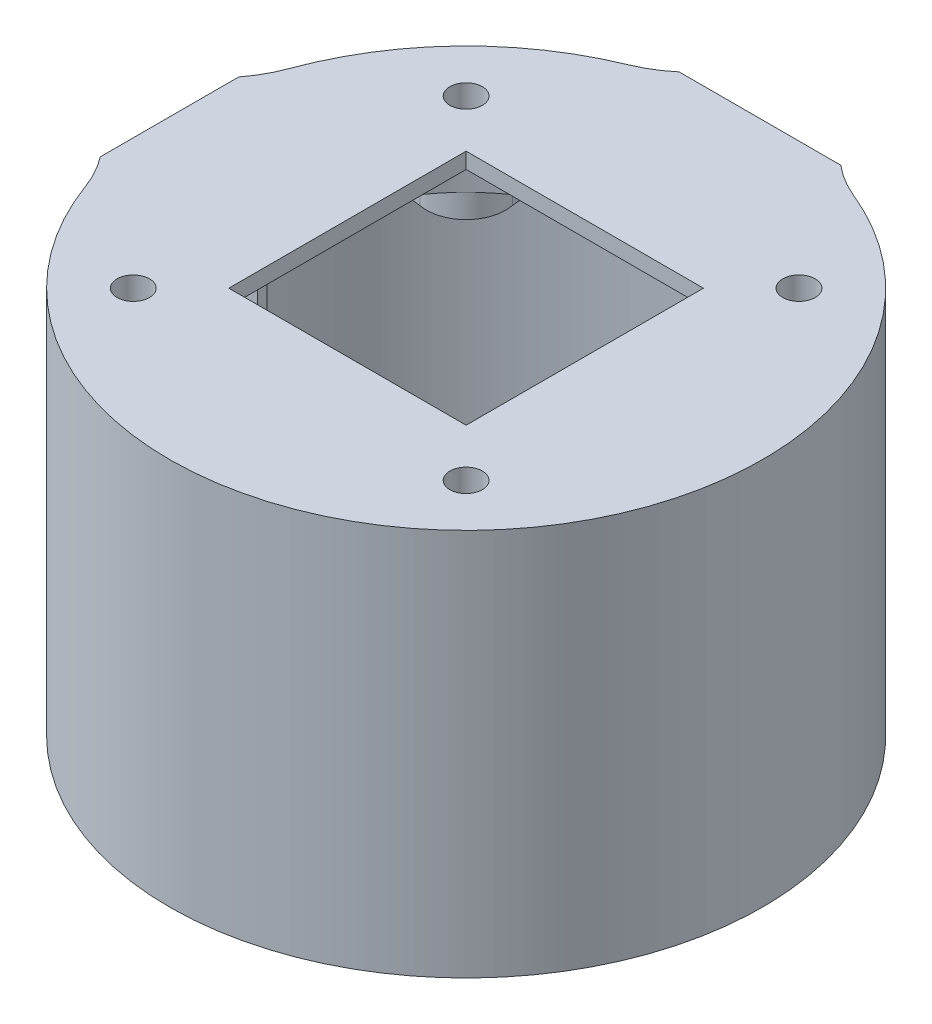
from build123d import *

# Parameters (mm, degrees)
SKETCH1_R               = 75
SKETCH1_R_2             = 70
BOSS_EXTRUDE1_DEPTH     = 78
SKETCH2_R               = 75
BOSS_EXTRUDE2_DEPTH     = 20
SKETCH3_R               = 4.1
SKETCH3_W               = 45
SKETCH3_H               = 45
CUT_EXTRUDE1_DEPTH      = 145.409140985
SKETCH5_W               = 45
SKETCH5_H               = 23
CUT_EXTRUDE2_DEPTH      = 18
SKETCH6_R               = 61
CUT_EXTRUDE3_DEPTH      = 6
SKETCH7_R               = 10
SKETCH7_R_2             = 4.1
BOSS_EXTRUDE3_DEPTH     = 6
SKETCH8_R               = 49.5
CUT_EXTRUDE4_DEPTH      = 10
CUT_EXTRUDE5_DEPTH      = 145.409140985
CUT_EXTRUDE5_DEPTH_BACK = 145.409140985
SKETCH10_W              = 15
SKETCH10_H              = 12.8
CUT_EXTRUDE6_DEPTH      = 10
CUT_EXTRUDE7_START      = -3
SKETCH11_W              = 20
SKETCH11_H              = 20
CUT_EXTRUDE7_DEPTH      = 10
CUT_EXTRUDE9_DEPTH      = 132.658649545
CUT_EXTRUDE9_DEPTH_BACK = 6
SKETCH13_R              = 9
BOSS_EXTRUDE4_DEPTH     = 98
SKETCH15_W              = 15.1
SKETCH15_H              = 22
CUT_EXTRUDE10_DEPTH     = 20.4
FILLET1_R               = 30
SKETCH16_W              = 15.1
SKETCH16_H              = 20
CUT_EXTRUDE11_DEPTH     = 2
SKETCH17_W              = 15.1
SKETCH17_H              = 12.8
CUT_EXTRUDE12_DEPTH     = 208.32046993
CHAMFER1_SIZE           = 20
CHAMFER1_SIZE2          = 69.748288877
CUT_EXTRUDE13_START     = -20
SKETCH20_W              = 10
SKETCH20_H              = 30
CUT_EXTRUDE13_DEPTH     = 30
BOSS_EXTRUDE6_START     = -48.000001
SKETCH21_W              = 7.222791441
SKETCH21_H              = 35
BOSS_EXTRUDE6_DEPTH     = 98.000001
SKETCH22_W              = 30
SKETCH22_H              = 30
CUT_EXTRUDE15_DEPTH     = 198.176147378
FILLET2_R               = 30
SKETCH23_W              = 60
SKETCH23_H              = 60
CUT_EXTRUDE16_DEPTH     = 156.300037396
SKETCH25_R              = 6
CUT_EXTRUDE17_DEPTH     = 6
SKETCH26_R              = 11
CUT_EXTRUDE18_DEPTH     = 6
FILLET4_R               = 10


with BuildPart() as part:
    # Sketch1 → Boss-Extrude1 (new body)
    with BuildSketch(Plane(origin=(0, 0, 0), x_dir=(1, 0, 0), z_dir=(0, 1, 0))):
        with Locations(Location((0, 0, 0), (0, 0, 270))):
            Circle(SKETCH1_R)
        with Locations(Location((0, 0, 0), (0, 0, 270))):
            Circle(SKETCH1_R_2, mode=Mode.SUBTRACT)
    extrude(amount=BOSS_EXTRUDE1_DEPTH)

    # Sketch2 → Boss-Extrude2 (add)
    with BuildSketch(Plane(origin=(0, 78, 0), x_dir=(1, 0, 0), z_dir=(0, 1, 0))):
        with Locations(Location((0, 0, 0), (0, 0, 270))):
            Circle(SKETCH2_R)
    extrude(amount=BOSS_EXTRUDE2_DEPTH)

    # Sketch3 → Cut-Extrude1 (cut, through all)
    with BuildSketch(Plane(origin=(0, 98, 0), x_dir=(1, 0, 0), z_dir=(0, 1, 0))):
        with Locations(Location((-42.072853481, -42.072853481, 0), (0, 0, 270))):
            Circle(SKETCH3_R)
        with Locations(Location((-42.072853481, 42.072853481, 0), (0, 0, 270))):
            Circle(SKETCH3_R)
        with Locations(Location((42.072853481, 42.072853481, 0), (0, 0, 270))):
            Circle(SKETCH3_R)
        with Locations(Location((42.072853481, -42.072853481, 0), (0, 0, 270))):
            Circle(SKETCH3_R)
        Rectangle(SKETCH3_W, SKETCH3_H)
    extrude(amount=-CUT_EXTRUDE1_DEPTH, mode=Mode.SUBTRACT)

    # Sketch5 → Cut-Extrude2 (cut)
    with BuildSketch(Plane.XZ.offset(-78)):
        with Locations((0, 34)):
            Rectangle(SKETCH5_W, SKETCH5_H)
    extrude(amount=-CUT_EXTRUDE2_DEPTH, mode=Mode.SUBTRACT)

    # Sketch6 → Cut-Extrude3 (cut)
    with BuildSketch(Plane.XZ.offset(-78)):
        Circle(SKETCH6_R)
    extrude(amount=-CUT_EXTRUDE3_DEPTH, mode=Mode.SUBTRACT)

    # Sketch7 → Boss-Extrude3 (add)
    # profile 1 of 4: a face of its own
    with BuildSketch(Plane.XZ.offset(-84)):
        with Locations((-42.072853481, -42.072853481)):
            Circle(SKETCH7_R)
        with Locations(Location((-42.072853481, -42.072853481, 0), (0, 0, 90))):
            Circle(SKETCH7_R_2, mode=Mode.SUBTRACT)
    # profile 2 of 4: a face of its own
    with BuildSketch(Plane.XZ.offset(-84)):
        with Locations((-42.072853481, 42.072853481)):
            Circle(SKETCH7_R)
        with Locations(Location((-42.072853481, 42.072853481, 0), (0, 0, 90))):
            Circle(SKETCH7_R_2, mode=Mode.SUBTRACT)
    # profile 3 of 4: a face of its own
    with BuildSketch(Plane.XZ.offset(-84)):
        with Locations((42.072853481, -42.072853481)):
            Circle(SKETCH7_R)
        with Locations(Location((42.072853481, -42.072853481, 0), (0, 0, 90))):
            Circle(SKETCH7_R_2, mode=Mode.SUBTRACT)
    # profile 4 of 4: a face of its own
    with BuildSketch(Plane.XZ.offset(-84)):
        with Locations((42.072853481, 42.072853481)):
            Circle(SKETCH7_R)
        with Locations(Location((42.072853481, 42.072853481, 0), (0, 0, 90))):
            Circle(SKETCH7_R_2, mode=Mode.SUBTRACT)
    extrude(amount=BOSS_EXTRUDE3_DEPTH)

    # Sketch8 → Cut-Extrude4 (cut)
    with BuildSketch(Plane.XZ.offset(-84)):
        Circle(SKETCH8_R)
    extrude(amount=-CUT_EXTRUDE4_DEPTH, mode=Mode.SUBTRACT)

    # Sketch9 → Cut-Extrude5 (cut, two sides: drawn at the far end of the back side and taken through both)
    with BuildSketch(Plane.XZ.offset(-CUT_EXTRUDE5_DEPTH_BACK)):
        Polygon((359.222745321, -74.624057783), (7.5, -74.624057783), (-7.5, -74.624057783), (-359.222745321, -74.624057783), (-359.222745321, -778.069548425), (359.222745321, -778.069548425), align=None)
    extrude(amount=CUT_EXTRUDE5_DEPTH + CUT_EXTRUDE5_DEPTH_BACK, mode=Mode.SUBTRACT)

    # Sketch10 → Cut-Extrude6 (cut)
    with BuildSketch(Plane(origin=(0, 0, -74.624057783), x_dir=(-1, 0, 0), z_dir=(0, 0, -1))):
        with Locations((0, 14)):
            Rectangle(SKETCH10_W, SKETCH10_H)
    extrude(amount=-CUT_EXTRUDE6_DEPTH, mode=Mode.SUBTRACT)

    # Sketch11 → Cut-Extrude7 (cut)
    with BuildSketch(Plane(origin=(0, 0, -74.624057783), x_dir=(-1, 0, 0), z_dir=(0, 0, -1)).offset(CUT_EXTRUDE7_START)):
        with Locations((0, 14)):
            Rectangle(SKETCH11_W, SKETCH11_H)
    extrude(amount=-CUT_EXTRUDE7_DEPTH, mode=Mode.SUBTRACT)

    # Sketch13 → Cut-Extrude9 (cut, two sides: drawn at the far end of the back side and taken through both)
    with BuildSketch(Plane.XZ.offset(-78).offset(-CUT_EXTRUDE9_DEPTH_BACK)):
        with Locations((61, 0)):
            Circle(SKETCH13_R)
    extrude(amount=CUT_EXTRUDE9_DEPTH + CUT_EXTRUDE9_DEPTH_BACK, mode=Mode.SUBTRACT)

    # Sketch14 → Boss-Extrude4 (add)
    with BuildSketch(Plane.XZ):
        with BuildLine():
            Line((10, -94.282032303), (-10, -94.282032303))
            Line((-10, -94.282032303), (-10, -69.282032303))
            ThreePointArc((-10, -69.282032303), (0, -70), (10, -69.282032303))
            Line((10, -69.282032303), (10, -94.282032303))
        make_face()
    extrude(amount=-BOSS_EXTRUDE4_DEPTH)

    # Sketch15 → Cut-Extrude10 (cut)
    with BuildSketch(Plane.XZ):
        with Locations((0, -80.591648206)):
            Rectangle(SKETCH15_W, SKETCH15_H)
    extrude(amount=-CUT_EXTRUDE10_DEPTH, mode=Mode.SUBTRACT)

    # Fillet1
    # the kernel refuses this fillet: 30 mm, written as the material it adds along each edge
    with BuildSketch(Plane(origin=(10, 98, -74.330343737), x_dir=(0, 0, -1), z_dir=(0, -1, 0))) as fillet1_piece_1:
        with BuildLine():
            CenterArc((22.808141372, 29.863701669), FILLET1_R, 202.312270951, 62.224029165)
            Line((-4.945711516, 18.474072621), (-5.500788574, 18.24628004))
            ThreePointArc((-5.500788574, 18.24628004), (-2.46118345, 9.240161115), (-0.59464275, -0.08))
            Line((-0.59464275, -0.08), (0, -0.6))
            ThreePointArc((0, -0.6), (9.975844283, -0.6), (19.89455951, -0.597274033))
            Line((19.89455951, -0.597274033), (19.951688566, 0))
        make_face()
    extrude(amount=98)
    with BuildSketch(Plane(origin=(-10, 98, -74.330343737), x_dir=(0, 0, -1), z_dir=(0, -1, 0))) as fillet1_piece_2:
        with BuildLine():
            CenterArc((22.808141372, -29.863701669), FILLET1_R, 95.463699883, 62.224029165)
            Line((-4.945711516, -18.474072621), (-5.500788574, -18.24628004))
            ThreePointArc((-5.500788574, -18.24628004), (-2.46118345, -9.240161115), (-0.59464275, 0.08))
            Line((-0.59464275, 0.08), (0, 0.6))
            ThreePointArc((0, 0.6), (9.975844283, 0.6), (19.89455951, 0.597274033))
            Line((19.89455951, 0.597274033), (19.951688566, 0))
        make_face()
    extrude(amount=98)

    # Sketch16 → Cut-Extrude11 (cut)
    with BuildSketch(Plane.XZ.offset(-20.4)):
        with Locations((0, -81.591648206)):
            Rectangle(SKETCH16_W, SKETCH16_H)
    extrude(amount=-CUT_EXTRUDE11_DEPTH, mode=Mode.SUBTRACT)

    # Sketch17 → Cut-Extrude12 (cut, through all)
    with BuildSketch(Plane.XY.offset(-91.591648206)):
        with Locations((0, 16)):
            Rectangle(SKETCH17_W, SKETCH17_H)
    extrude(amount=-CUT_EXTRUDE12_DEPTH, mode=Mode.SUBTRACT)

    # Chamfer1
    chamfer1_edges = [part.edges().sort_by_distance(p)[0] for p in [
        (0, 98, -94.282032303),
    ]]
    chamfer1_side = [part.faces().sort_by_distance(p)[0] for p in [
        (-13.95523156, 98, -77.914190335),
    ]]
    chamfer(chamfer1_edges, length=CHAMFER1_SIZE, length2=CHAMFER1_SIZE2, reference=chamfer1_side[0])

    # Sketch20 → Cut-Extrude13 (cut)
    with BuildSketch(Plane.XZ.offset(CUT_EXTRUDE13_START)):
        with Locations((-70, 0)):
            Rectangle(SKETCH20_W, SKETCH20_H)
    extrude(amount=-CUT_EXTRUDE13_DEPTH, mode=Mode.SUBTRACT)

    # Sketch21 → Boss-Extrude6 (add)
    with BuildSketch(Plane.XZ.offset(-50).offset(BOSS_EXTRUDE6_START)):
        with Locations((-71.38860428, 0)):
            Rectangle(SKETCH21_W, SKETCH21_H)
    extrude(amount=BOSS_EXTRUDE6_DEPTH)

    # Sketch22 → Cut-Extrude15 (cut, through all)
    with BuildSketch(Plane(origin=(-67.777208559, 0, 0), x_dir=(0, 0, -1), z_dir=(1, 0, 0))):
        with Locations((0, 63)):
            Rectangle(SKETCH22_W, SKETCH22_H)
    extrude(amount=-CUT_EXTRUDE15_DEPTH, mode=Mode.SUBTRACT)

    # Fillet2
    # the kernel refuses this fillet: 30 mm, written as the material it adds along each edge
    with BuildSketch(Plane(origin=(-72.929760729, 98, -17.5), x_dir=(0.2883469649842646, 0, -0.9575259932682575), z_dir=(0, -1, 0))) as fillet2_piece_1:
        with BuildLine():
            CenterArc((10.253688675, -29.951285387), FILLET2_R, 93.265618259, 17.938271436)
            Line((-0.596947211, -1.982307914), (-0.813959928, -1.422928365))
            ThreePointArc((-0.813959928, -1.422928365), (-0.872989201, -0.818145778), (-0.574515596, 0.173008179))
            Line((-0.574515596, 0.173008179), (0.034178962, 0.599025708))
            ThreePointArc((0.034178962, 0.599025708), (4.272370281, 0.478213468), (8.5105616, 0.599025708))
            Line((8.5105616, 0.599025708), (8.544740562, 0))
        make_face()
    extrude(amount=98)
    with BuildSketch(Plane(origin=(-72.929760729, 98, 17.5), x_dir=(-1, 0, 0), z_dir=(0, -1, 0))) as fillet2_piece_2:
        with BuildLine():
            CenterArc((25.722514281, -18.454535672), FILLET2_R, 142.037093224, 17.938271436)
            Line((-2.463850008, -8.181811194), (-3.027577293, -7.976356704))
            ThreePointArc((-3.027577293, -7.976356704), (-1.68982683, -3.953014195), (-0.583438086, 0.14))
            Line((-0.583438086, 0.14), (0, 0.6))
            ThreePointArc((0, 0.6), (1.035119635, 0.6), (1.597193771, 0.369090713))
            Line((1.597193771, 0.369090713), (2.070239271, 0))
        make_face()
    extrude(amount=98)

    # Sketch23 → Cut-Extrude16 (cut, through all)
    with BuildSketch(Plane(origin=(0, 98, 0), x_dir=(1, 0, 0), z_dir=(0, 1, 0))):
        Rectangle(SKETCH23_W, SKETCH23_H)
    extrude(amount=-CUT_EXTRUDE16_DEPTH, mode=Mode.SUBTRACT)

    # Sketch25 → Cut-Extrude17 (cut)
    with BuildSketch(Plane.XZ.offset(-78)):
        with Locations((0, 61)):
            Circle(SKETCH25_R)
    extrude(amount=-CUT_EXTRUDE17_DEPTH, mode=Mode.SUBTRACT)

    # Sketch26 → Cut-Extrude18 (cut)
    with BuildSketch(Plane.XZ.offset(-78)):
        with Locations((-61, 0)):
            Circle(SKETCH26_R)
    extrude(amount=-CUT_EXTRUDE18_DEPTH, mode=Mode.SUBTRACT)

    # Fillet4
    fillet4_edges = [part.edges().sort_by_distance(p)[0] for p in [
        (-49.607445277, 81, -35.497906602),
        (-35.497906602, 81, -49.607445277),
        (-35.497906602, 81, 49.607445277),
        (-49.607445277, 81, 35.497906602),
        (49.607445277, 81, -35.497906602),
        (35.497906602, 81, -49.607445277),
        (49.607445277, 81, 35.497906602),
        (35.497906602, 81, 49.607445277),
    ]]
    fillet(fillet4_edges, radius=FILLET4_R)


solid = part.part
